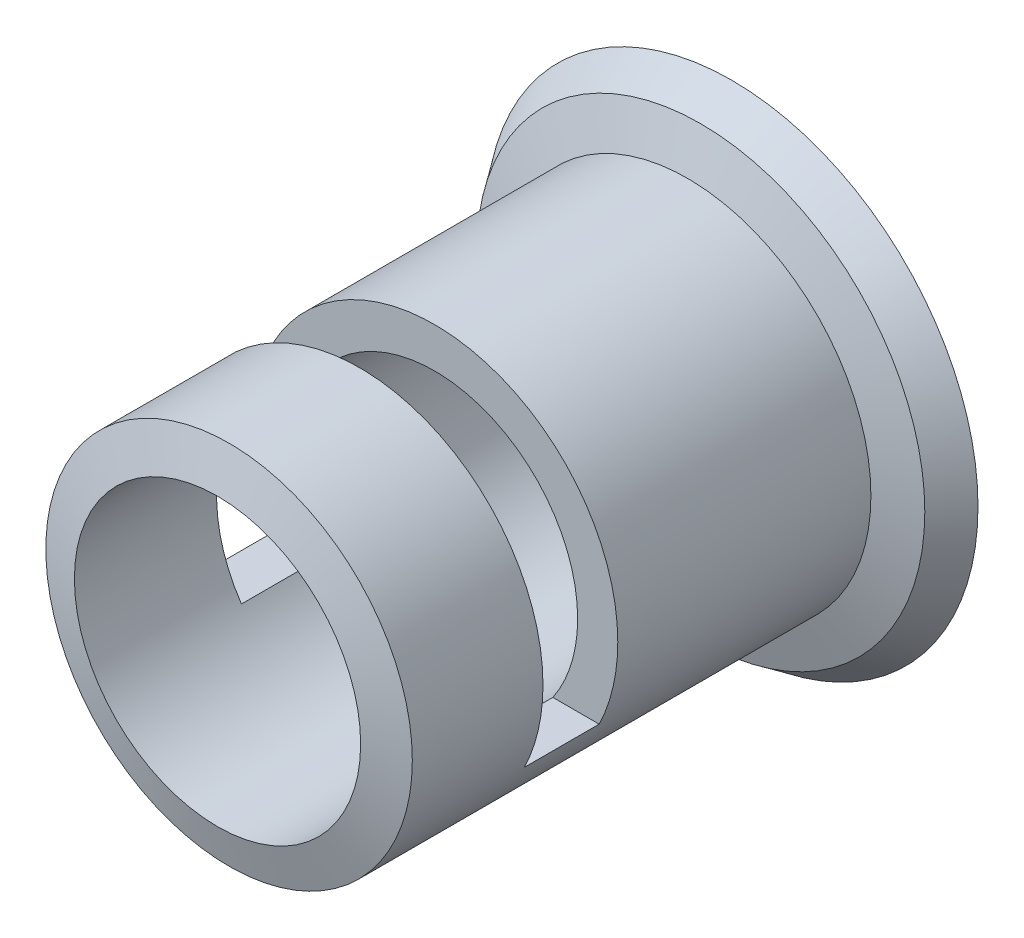
from build123d import *

# Parameters (mm, degrees)
CUT_EXTRUDE1_DEPTH      = 152.86468403
CUT_EXTRUDE1_DEPTH_BACK = 152.86468403
SKETCH2_W               = 18.290794
SKETCH2_H               = 72.242999565


with BuildPart() as part:
    # Sketch1 → Revolve1 (revolve)
    with BuildSketch(Plane(origin=(0, 0, 0), x_dir=(0, 0, -1), z_dir=(1, 0, 0))):
        Polygon((0, 34.996755), (2.824988, 44.809537), (114.961162, 44.809537), (118.13794, 54.811676), (125.76175, 60.194952), (125.76175, 34.996755), align=None)
    revolve(axis=Axis((0, 0, 0), (0, 0, -1)))

    # Sketch2 → Cut-Extrude1 (cut, two sides: drawn at the far end of the back side and taken through both)
    with BuildSketch(Plane(origin=(0, 0, 0), x_dir=(0, 0, -1), z_dir=(1, 0, 0)).offset(-CUT_EXTRUDE1_DEPTH_BACK)):
        with Locations((43.920283, 16.428879782)):
            Rectangle(SKETCH2_W, SKETCH2_H)
    extrude(amount=CUT_EXTRUDE1_DEPTH + CUT_EXTRUDE1_DEPTH_BACK, mode=Mode.SUBTRACT)


solid = part.part
